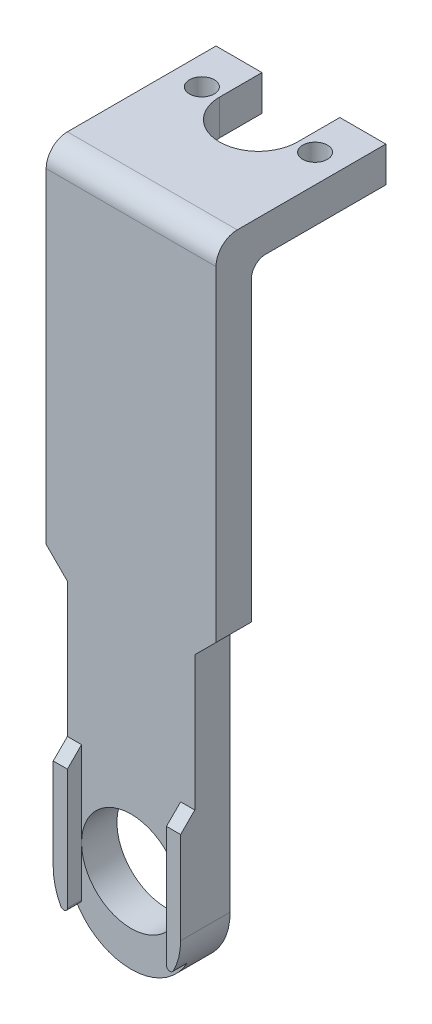
from build123d import *

# Parameters (mm, degrees)
SKETCH1_R           = 5.5
SKETCH1_R_2         = 1.75
BOSS_EXTRUDE2_DEPTH = 5
SKETCH2_W           = 24
SKETCH2_H           = 5
BOSS_EXTRUDE3_DEPTH = 90
FILLET1_R           = 3
FILLET2_R           = 2
SKETCH3_R           = 7
CUT_EXTRUDE1_DEPTH  = 60
SKETCH4_W           = 24
SKETCH4_H           = 2
CUT_EXTRUDE2_DEPTH  = 98.432027588
SKETCH5_W           = 11
SKETCH5_H           = 6
CUT_EXTRUDE3_DEPTH  = 98.432027588
CUT_EXTRUDE4_DEPTH  = 94.914855055
FILLET4_R           = 9
BOSS_EXTRUDE4_DEPTH = 2
CHAMFER1_SIZE       = 2
FILLET5_R           = 0.5


with BuildPart() as part:
    # Sketch1 → Boss-Extrude2 (new body)
    with BuildSketch(Plane(origin=(0, 0, 0), x_dir=(1, 0, 0), z_dir=(0, 1, 0))):
        Polygon((-12, 8), (-12, -18), (12, -18), (12, 5.5), (12, 8), (0, 8), align=None)
        with Locations(Location((0, 0, 0), (0, 0, 270))):
            Circle(SKETCH1_R, mode=Mode.SUBTRACT)
        with Locations(Location((-8, 0, 0), (0, 0, 270))):
            Circle(SKETCH1_R_2, mode=Mode.SUBTRACT)
        with Locations(Location((8, 0, 0), (0, 0, 270))):
            Circle(SKETCH1_R_2, mode=Mode.SUBTRACT)
    extrude(amount=BOSS_EXTRUDE2_DEPTH)

    # Sketch2 → Boss-Extrude3 (add)
    with BuildSketch(Plane.XZ):
        with Locations((0, 15.5)):
            Rectangle(SKETCH2_W, SKETCH2_H)
    extrude(amount=BOSS_EXTRUDE3_DEPTH)

    # Fillet1
    fillet1_edges = [part.edges().sort_by_distance(p)[0] for p in [
        (0, 5, 18),
    ]]
    fillet(fillet1_edges, radius=FILLET1_R)

    # Fillet2
    fillet2_edges = [part.edges().sort_by_distance(p)[0] for p in [
        (0, 0, 13),
    ]]
    fillet(fillet2_edges, radius=FILLET2_R)

    # Sketch3 → Cut-Extrude1 (cut)
    with BuildSketch(Plane.XY.offset(18)):
        with Locations((0, -78)):
            Circle(SKETCH3_R)
    extrude(amount=-CUT_EXTRUDE1_DEPTH, mode=Mode.SUBTRACT)

    # Sketch4 → Cut-Extrude2 (cut, through all)
    with BuildSketch(Plane(origin=(0, 5, 0), x_dir=(1, 0, 0), z_dir=(0, 1, 0))):
        with Locations((0, 7)):
            Rectangle(SKETCH4_W, SKETCH4_H)
    extrude(amount=-CUT_EXTRUDE2_DEPTH, mode=Mode.SUBTRACT)

    # Sketch5 → Cut-Extrude3 (cut, through all)
    with BuildSketch(Plane(origin=(0, 5, 0), x_dir=(1, 0, 0), z_dir=(0, 1, 0))):
        with Locations((0, 3)):
            Rectangle(SKETCH5_W, SKETCH5_H)
    extrude(amount=-CUT_EXTRUDE3_DEPTH, mode=Mode.SUBTRACT)

    # Sketch6 → Cut-Extrude4 (cut, through all)
    with BuildSketch(Plane.XY.offset(18)):
        Polygon((-12, -44), (-9, -47), (-9, -90), (-12, -90), align=None)
        Polygon((9, -90), (12, -90), (12, -44), (9, -47), align=None)
    extrude(amount=-CUT_EXTRUDE4_DEPTH, mode=Mode.SUBTRACT)

    # Fillet4
    fillet4_edges = [part.edges().sort_by_distance(p)[0] for p in [
        (9, -90, 15.5),
        (-9, -90, 15.5),
    ]]
    fillet(fillet4_edges, radius=FILLET4_R - 0.0001)  # a hair under: the kernel refuses the full size

    # Sketch7 → Boss-Extrude4 (add)
    with BuildSketch(Plane.XY.offset(18)):
        with BuildLine():
            Line((-7, -68), (-7, -86.656854249))
            ThreePointArc((-7, -86.656854249), (-8.485281374, -84), (-9, -81))
            Line((-9, -81), (-9, -68))
            Line((-9, -68), (-7, -68))
        make_face()
        with BuildLine():
            Line((7, -68), (9, -68))
            Line((9, -68), (9, -81))
            ThreePointArc((9, -81), (8.485281374, -84), (7, -86.656854249))
            Line((7, -86.656854249), (7, -68))
        make_face()
    extrude(amount=BOSS_EXTRUDE4_DEPTH)

    # Chamfer1
    chamfer1_edges = [part.edges().sort_by_distance(p)[0] for p in [
        (8, -68, 18),
        (-8, -68, 18),
    ]]
    chamfer(chamfer1_edges, length=CHAMFER1_SIZE - 0.0001)  # a hair under: the kernel refuses the full size

    # Fillet5
    fillet5_edges = [part.edges().sort_by_distance(p)[0] for p in [
        (-7, -86.656854249, 19),
        (7, -86.656854249, 19),
    ]]
    fillet(fillet5_edges, radius=FILLET5_R)


solid = part.part
